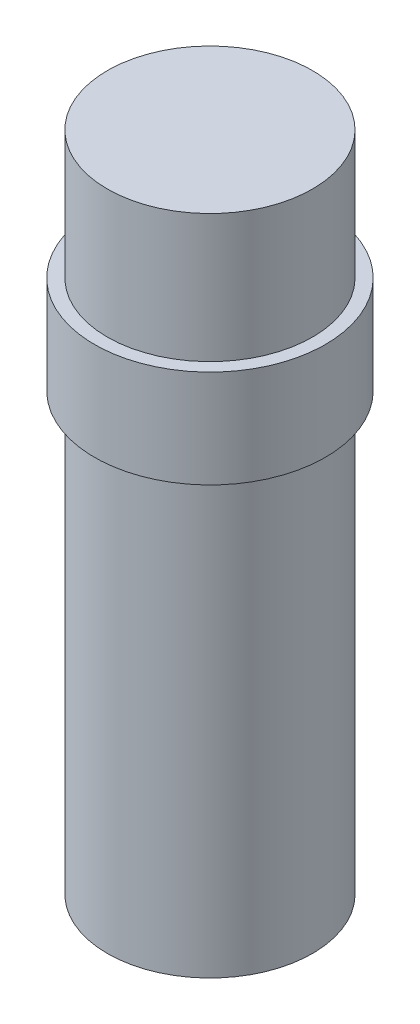
from build123d import *

# Parameters (mm, degrees)
SKETCH1_R           = 4
BOSS_EXTRUDE1_DEPTH = 17
SKETCH2_R           = 4.5
BOSS_EXTRUDE2_DEPTH = 3.81
SKETCH3_R           = 4
BOSS_EXTRUDE3_DEPTH = 5


with BuildPart() as part:
    # Sketch1 → Boss-Extrude1 (new body)
    with BuildSketch(Plane(origin=(0, 0, 0), x_dir=(1, 0, 0), z_dir=(0, 1, 0))):
        Circle(SKETCH1_R)
    extrude(amount=BOSS_EXTRUDE1_DEPTH)

    # Sketch2 → Boss-Extrude2 (add)
    with BuildSketch(Plane(origin=(0, 17, 0), x_dir=(1, 0, 0), z_dir=(0, 1, 0))):
        Circle(SKETCH2_R)
    extrude(amount=BOSS_EXTRUDE2_DEPTH)

    # Sketch3 → Boss-Extrude3 (add)
    with BuildSketch(Plane(origin=(0, 20.81, 0), x_dir=(1, 0, 0), z_dir=(0, 1, 0))):
        Circle(SKETCH3_R)
    extrude(amount=BOSS_EXTRUDE3_DEPTH)


solid = part.part
